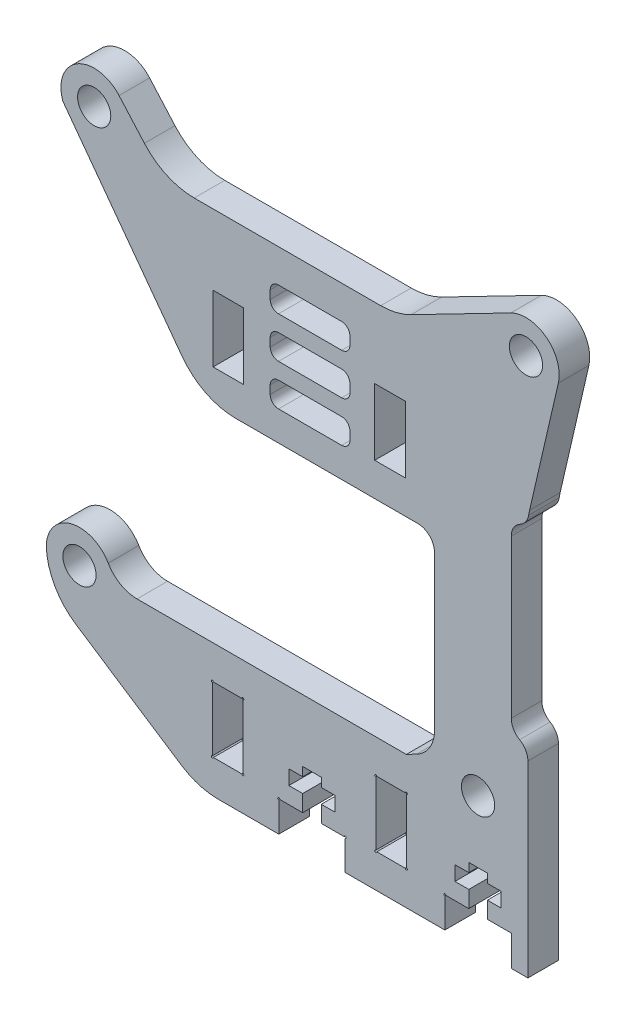
from build123d import *

# Parameters (mm, degrees)
SKETCH1_R           = 3.175
SKETCH1_R_2         = 3.174951128
BOSS_EXTRUDE1_DEPTH = 5.842
FILLET2_R           = 12.7
FILLET3_R           = 6.35
CUT_EXTRUDE1_DEPTH  = 87.813654174
BOSS_EXTRUDE2_START = -5.842
BOSS_EXTRUDE2_DEPTH = 5.842
FILLET4_R           = 6.35
SKETCH5_W           = 5.842
SKETCH5_H           = 12.7
SKETCH5_R           = 3.175
BOSS_EXTRUDE3_DEPTH = 5.842
FILLET5_R           = 3.175
FILLET6_R           = 12.7
CUT_EXTRUDE3_DEPTH  = 136.823266385
FILLET7_R           = 3.175
SKETCH8_W           = 15.24
SKETCH8_H           = 4.7625
CUT_EXTRUDE4_DEPTH  = 136.823266529
FILLET8_R           = 1.5875


with BuildPart() as part:
    # Sketch1 → Boss-Extrude1 (new body)
    with BuildSketch(Plane.XY):
        with BuildLine():
            Line((0, 0), (-51.530803591, 0))
            Line((-51.530803591, 0), (-80.587958697, 19.05))
            Line((-80.587958697, 19.05), (-80.587958697, 25.4))
            ThreePointArc((-80.587958697, 25.4), (-74.237958697, 31.75), (-67.887958697, 25.4))
            Line((-67.887958697, 25.4), (-63.5, 25.4))
            Line((-63.5, 25.4), (-11.753958697, 25.4))
            Line((-11.753958697, 25.4), (-0.97772826, 31.02846642))
            ThreePointArc((-0.97772826, 31.02846642), (5.252518949, 30.830896444), (8.311992431, 25.4))
            Line((8.311992431, 25.4), (8.311992431, 0))
            Line((8.311992431, 0), (1.962041303, 0))
            Line((1.962041303, 0), (0, 0))
        make_face()
        with Locations((-74.237958697, 25.4)):
            Circle(SKETCH1_R, mode=Mode.SUBTRACT)
        with Locations((1.962041303, 25.4)):
            Circle(SKETCH1_R_2, mode=Mode.SUBTRACT)
        with BuildLine():
            Line((-17.397521197, 18.95), (-11.952396197, 18.95))
            ThreePointArc((-11.952396197, 18.95), (-11.613642195, 19.090316502), (-11.753958697, 18.7515625))
            Line((-11.753958697, 18.7515625), (-11.753958697, 6.6484375))
            ThreePointArc((-11.753958697, 6.6484375), (-11.613642195, 6.309683498), (-11.952396197, 6.45))
            Line((-11.952396197, 6.45), (-17.397521197, 6.45))
            ThreePointArc((-17.397521197, 6.45), (-17.736275199, 6.309683498), (-17.595958697, 6.6484375))
            Line((-17.595958697, 6.6484375), (-17.595958697, 18.7515625))
            ThreePointArc((-17.595958697, 18.7515625), (-17.736275199, 19.090316502), (-17.397521197, 18.95))
        make_face(mode=Mode.SUBTRACT)
        with BuildLine():
            Line((-43.194396197, 18.95), (-48.639521197, 18.95))
            ThreePointArc((-48.639521197, 18.95), (-48.978275199, 19.090316502), (-48.837958697, 18.7515625))
            Line((-48.837958697, 18.7515625), (-48.837958697, 6.6484375))
            ThreePointArc((-48.837958697, 6.6484375), (-48.978275199, 6.309683498), (-48.639521197, 6.45))
            Line((-48.639521197, 6.45), (-43.194396197, 6.45))
            ThreePointArc((-43.194396197, 6.45), (-42.855642195, 6.309683498), (-42.995958697, 6.6484375))
            Line((-42.995958697, 6.6484375), (-42.995958697, 18.7515625))
            ThreePointArc((-42.995958697, 18.7515625), (-42.855642195, 19.090316502), (-43.194396197, 18.95))
        make_face(mode=Mode.SUBTRACT)
    extrude(amount=BOSS_EXTRUDE1_DEPTH)

    # Fillet2
    # the kernel refuses this fillet: 12.7 mm, written as the material it takes off along each edge
    with BuildSketch(Plane(origin=(-51.530803591, 0, -9.479879108), x_dir=(1, 0, 0), z_dir=(0, 0, 1))) as fillet2_piece_1:
        with BuildLine():
            CenterArc((FILLET2_R * 0.298578869541, FILLET2_R), FILLET2_R, 236.750973169, 33.249026831)
            Line((-FILLET2_R * 0.249700155583, FILLET2_R * 0.163704531514), (0, 0))
            Line((0, 0), (FILLET2_R * 0.298578869541, 0))
        make_face()
    extrude(amount=24.801758216, mode=Mode.SUBTRACT)
    with BuildSketch(Plane(origin=(-80.587958697, 19.05, -17.118170795), x_dir=(0, 1, 0), z_dir=(0, 0, 1))) as fillet2_piece_2:
        with BuildLine():
            CenterArc((6.866738852, -12.689483085), FILLET2_R, 92.331900044, 54.419073124)
            Line((-3.754213598, -5.726339466), (0, 0))
            Line((0, 0), (6.35, 0))
        make_face()
    extrude(amount=40.078341589, mode=Mode.SUBTRACT)

    # Fillet3
    fillet3_edges = [part.edges().sort_by_distance(p)[0] for p in [
        (-67.887958697, 25.4, 2.921),
    ]]
    fillet(fillet3_edges, radius=FILLET3_R)

    # Sketch2 → Cut-Extrude1 (cut, through all)
    with BuildSketch(Plane.XY.offset(5.842)):
        with BuildLine():
            Line((-4.388007569, 5.6435625), (-4.388007569, 0))
            Line((-4.388007569, 0), (8.311992431, 0))
            Line((8.311992431, 0), (8.311992431, 5.6435625))
            Line((8.311992431, 5.6435625), (8.311992431, 5.842))
            Line((8.311992431, 5.842), (8.113554931, 5.842))
            Line((8.113554931, 5.842), (3.739992431, 5.842))
            Line((3.739992431, 5.842), (3.739992431, 9.017))
            Line((3.739992431, 9.017), (6.385358807, 9.017))
            Line((6.385358807, 9.017), (6.385358807, 11.795125))
            Line((6.385358807, 11.795125), (3.739992431, 11.795125))
            Line((3.739992431, 11.795125), (3.739992431, 13.49375))
            Line((3.739992431, 13.49375), (0.183992431, 13.49375))
            Line((0.183992431, 13.49375), (0.183992431, 11.795125))
            Line((0.183992431, 11.795125), (-2.461373945, 11.795125))
            Line((-2.461373945, 11.795125), (-2.461373945, 9.017))
            Line((-2.461373945, 9.017), (0.183992431, 9.017))
            Line((0.183992431, 9.017), (0.183992431, 5.842))
            Line((0.183992431, 5.842), (-4.189570069, 5.842))
            ThreePointArc((-4.189570069, 5.842), (-4.528324071, 5.982316502), (-4.388007569, 5.6435625))
        make_face()
        with BuildLine():
            Line((-36.138007569, 0), (-23.438007569, 0))
            Line((-23.438007569, 0), (-23.438007569, 5.6435625))
            ThreePointArc((-23.438007569, 5.6435625), (-23.297691068, 5.982316502), (-23.636445069, 5.842))
            Line((-23.636445069, 5.842), (-28.010007569, 5.842))
            Line((-28.010007569, 5.842), (-28.010007569, 9.017))
            Line((-28.010007569, 9.017), (-25.364641193, 9.017))
            Line((-25.364641193, 9.017), (-25.364641193, 11.795125))
            Line((-25.364641193, 11.795125), (-28.010007569, 11.795125))
            Line((-28.010007569, 11.795125), (-28.010007569, 13.49375))
            Line((-28.010007569, 13.49375), (-31.566007569, 13.49375))
            Line((-31.566007569, 13.49375), (-31.566007569, 11.795125))
            Line((-31.566007569, 11.795125), (-34.211373945, 11.795125))
            Line((-34.211373945, 11.795125), (-34.211373945, 9.017))
            Line((-34.211373945, 9.017), (-31.566007569, 9.017))
            Line((-31.566007569, 9.017), (-31.566007569, 5.842))
            Line((-31.566007569, 5.842), (-35.939570069, 5.842))
            ThreePointArc((-35.939570069, 5.842), (-36.278324071, 5.982316502), (-36.138007569, 5.6435625))
            Line((-36.138007569, 5.6435625), (-36.138007569, 0))
        make_face()
    extrude(amount=-CUT_EXTRUDE1_DEPTH, mode=Mode.SUBTRACT)

    # Sketch4 → Boss-Extrude2 (add)
    with BuildSketch(Plane.XY.offset(5.842).offset(BOSS_EXTRUDE2_START)):
        with BuildLine():
            Line((-0.97772826, 31.02846642), (-6.365843478, 28.21423321))
            Line((-6.365843478, 28.21423321), (-6.365843478, 76.2))
            Line((-6.365843478, 76.2), (11.486992431, 76.2))
            Line((11.486992431, 76.2), (11.486992431, 0))
            Line((11.486992431, 0), (8.311992431, 0))
            Line((8.311992431, 0), (8.311992431, 5.842))
            Line((8.311992431, 5.842), (8.311992431, 25.4))
            ThreePointArc((8.311992431, 25.4), (5.252518949, 30.830896444), (-0.97772826, 31.02846642))
        make_face()
    extrude(amount=BOSS_EXTRUDE2_DEPTH)

    # Fillet4
    fillet4_edges = [part.edges().sort_by_distance(p)[0] for p in [
        (-6.365843478, 28.21423321, 2.921),
    ]]
    fillet(fillet4_edges, radius=FILLET4_R)

    # Sketch5 → Boss-Extrude3 (add)
    with BuildSketch(Plane.XY.offset(5.842)):
        with BuildLine():
            Line((-50.815843478, 64.726058), (-6.365843478, 64.726058))
            Line((-6.365843478, 64.726058), (-6.365843478, 76.2))
            Line((-6.365843478, 76.2), (11.486992431, 76.2))
            Line((11.486992431, 76.2), (17.306484627, 101.397085752))
            ThreePointArc((17.306484627, 101.397085752), (15.017966748, 107.838377654), (8.211562687, 108.471164514))
            Line((8.211562687, 108.471164514), (-13.583990818, 97.244271998))
            Line((-13.583990818, 97.244271998), (-58.033990818, 97.244271998))
            Line((-58.033990818, 97.244271998), (-66.669907848, 107.028189421))
            ThreePointArc((-66.669907848, 107.028189421), (-74.65021795, 108.299341472), (-77.416513897, 100.706661867))
            Line((-77.416513897, 100.706661867), (-50.815843478, 64.726058))
        make_face()
        with Locations((-45.776642195, 77.426058)):
            Rectangle(SKETCH5_W, SKETCH5_H, mode=Mode.SUBTRACT)
        with Locations((-71.430642195, 102.826058)):
            Circle(SKETCH5_R, mode=Mode.SUBTRACT)
        with Locations((-14.873396197, 77.426058)):
            Rectangle(SKETCH5_W, SKETCH5_H, mode=Mode.SUBTRACT)
        with Locations((11.119357805, 102.826058)):
            Circle(SKETCH5_R, mode=Mode.SUBTRACT)
    extrude(amount=-BOSS_EXTRUDE3_DEPTH)

    # Fillet5
    fillet5_edges = [part.edges().sort_by_distance(p)[0] for p in [
        (-6.365843478, 64.726058, 2.921),
    ]]
    fillet(fillet5_edges, radius=FILLET5_R)

    # Fillet6
    fillet6_edges = [part.edges().sort_by_distance(p)[0] for p in [
        (11.486992431, 76.2, 2.921),
        (-50.815843478, 64.726058, 2.921),
        (-58.033990818, 97.244271998, 2.921),
        (-13.583990818, 97.244271998, 2.921),
    ]]
    fillet(fillet6_edges, radius=FILLET6_R)

    # Sketch7 → Cut-Extrude3 (cut, through all)
    with BuildSketch(Plane.XY.offset(5.842)):
        with BuildLine():
            Line((8.311992431, 71.577463591), (8.311992431, 41.414963591))
            ThreePointArc((8.311992431, 41.414963591), (9.2419284, 39.16989956), (11.486992431, 38.239963591))
            Line((11.486992431, 38.239963591), (11.486992431, 74.752463591))
            ThreePointArc((11.486992431, 74.752463591), (9.2419284, 73.822527621), (8.311992431, 71.577463591))
        make_face()
    extrude(amount=-CUT_EXTRUDE3_DEPTH, mode=Mode.SUBTRACT)

    # Fillet7
    fillet7_edges = [part.edges().sort_by_distance(p)[0] for p in [
        (11.486992431, 74.752463591, 2.921),
        (11.486992431, 38.239963591, 2.921),
    ]]
    fillet(fillet7_edges, radius=FILLET7_R)

    # Sketch8 → Cut-Extrude4 (cut, through all)
    with BuildSketch(Plane.XY.offset(5.842)):
        with Locations((-30.155642195, 80.639021998)):
            Rectangle(SKETCH8_W, SKETCH8_H)
        with Locations((-30.155642195, 88.513021998)):
            Rectangle(SKETCH8_W, SKETCH8_H)
        with Locations((-30.155642195, 72.765021998)):
            Rectangle(SKETCH8_W, SKETCH8_H)
    extrude(amount=-CUT_EXTRUDE4_DEPTH, mode=Mode.SUBTRACT)

    # Fillet8
    fillet8_edges = [part.edges().sort_by_distance(p)[0] for p in [
        (-37.775642195, 86.131771998, 2.921),
        (-37.775642195, 90.894271998, 2.921),
        (-22.535642195, 90.894271998, 2.921),
        (-22.535642195, 86.131771998, 2.921),
        (-22.535642195, 78.257771998, 2.921),
        (-37.775642195, 78.257771998, 2.921),
        (-37.775642195, 83.020271998, 2.921),
        (-22.535642195, 83.020271998, 2.921),
        (-22.535642195, 70.383771998, 2.921),
        (-37.775642195, 70.383771998, 2.921),
        (-37.775642195, 75.146271998, 2.921),
        (-22.535642195, 75.146271998, 2.921),
    ]]
    fillet(fillet8_edges, radius=FILLET8_R)


solid = part.part
